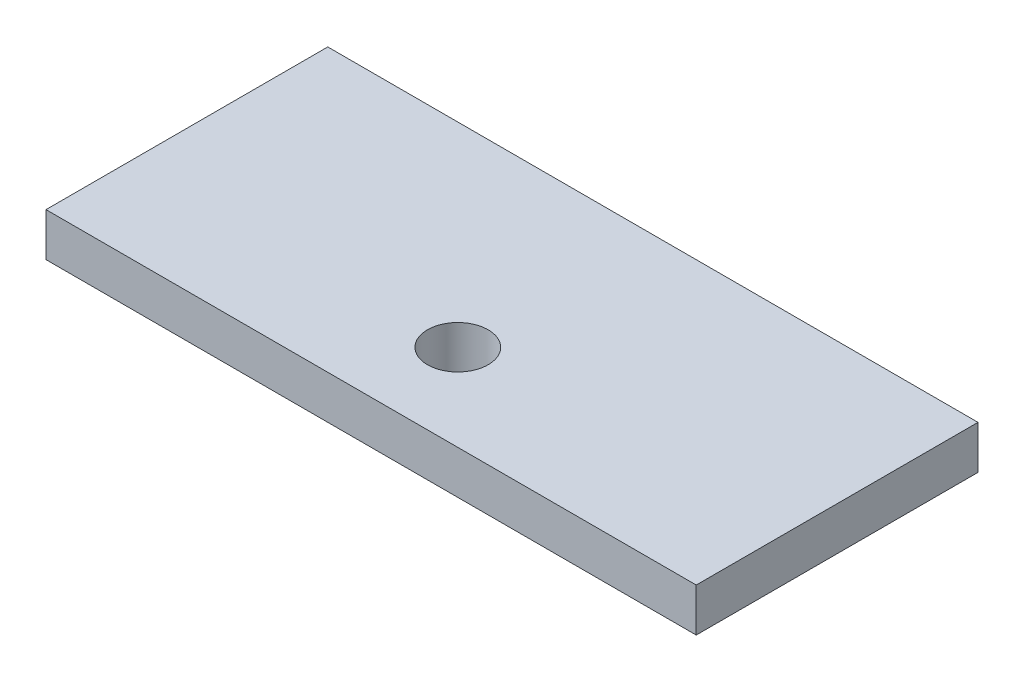
from build123d import *

# Parameters (mm, degrees)
SKETCH1_W               = 150
SKETCH1_H               = 65
BOSS_EXTRUDE1_DEPTH     = 10
CUT_EXTRUDE2_DEPTH      = 83.34834546
CUT_EXTRUDE2_DEPTH_BACK = 83.34834546
SKETCH2_R               = 7


with BuildPart() as part:
    # Sketch1 → Boss-Extrude1 (new body)
    with BuildSketch(Plane(origin=(0, 0, 0), x_dir=(1, 0, 0), z_dir=(0, 1, 0))):
        Rectangle(SKETCH1_W, SKETCH1_H)
    extrude(amount=BOSS_EXTRUDE1_DEPTH)

    # Sketch2 → Cut-Extrude2 (cut, two sides: drawn at the far end of the back side and taken through both)
    with BuildSketch(Plane(origin=(0, 0, 0), x_dir=(1, 0, 0), z_dir=(0, 1, 0)).offset(-CUT_EXTRUDE2_DEPTH_BACK)):
        with Locations((0, -12.5)):
            Circle(SKETCH2_R)
    extrude(amount=CUT_EXTRUDE2_DEPTH + CUT_EXTRUDE2_DEPTH_BACK, mode=Mode.SUBTRACT)


solid = part.part
